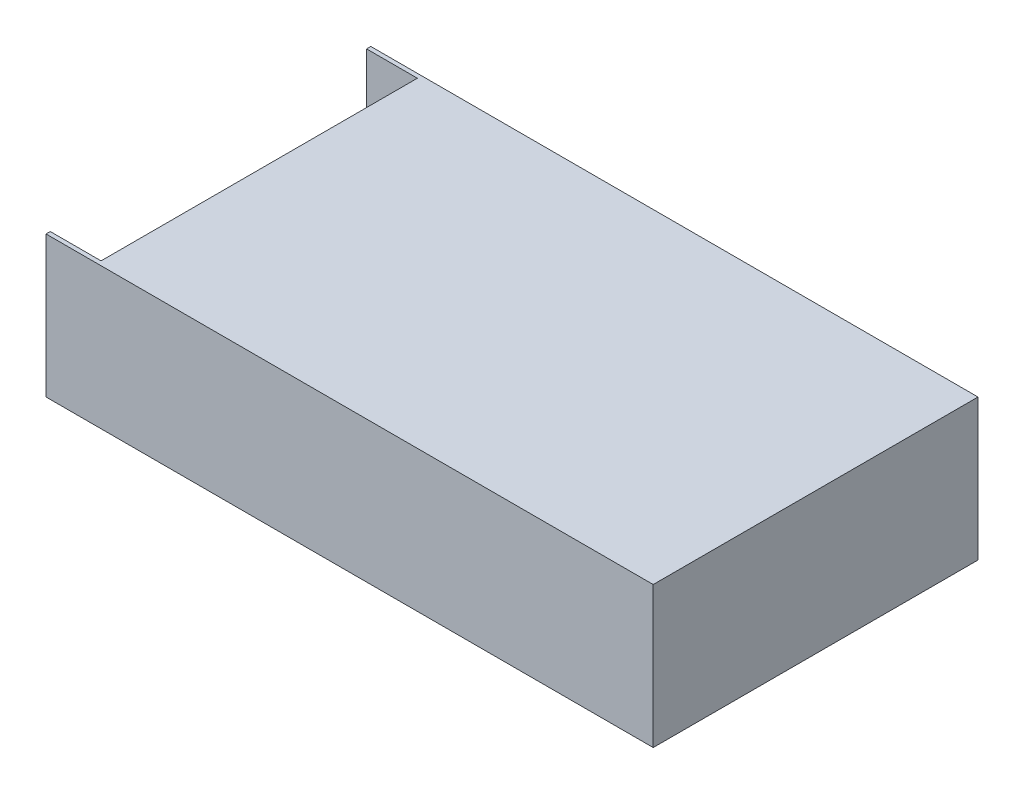
from build123d import *

# Parameters (mm, degrees)
SKETCH1_W           = 215
SKETCH1_H           = 115
BOSS_EXTRUDE1_DEPTH = 50
SKETCH2_W           = 18
SKETCH2_H           = 112
CUT_EXTRUDE2_DEPTH  = 25
SHELL1_START        = -84.5
SHELL1_OUTLINE_W    = 45
SHELL1_OUTLINE_H    = 105
SHELL1_DEPTH        = 187
SHELL1_START_2      = -102.5
SHELL1_2_OUTLINE_W  = 20
SHELL1_2_OUTLINE_H  = 105
SHELL1_2_DEPTH      = 18


# Read off the part's stored shape, not the designer's step: Shell1
with BuildPart() as part:
    # Sketch1 → Boss-Extrude1 (new body)
    with BuildSketch(Plane(origin=(0, 0, 0), x_dir=(1, 0, 0), z_dir=(0, 1, 0))):
        Rectangle(SKETCH1_W, SKETCH1_H)
    extrude(amount=BOSS_EXTRUDE1_DEPTH)

    # Sketch2 → Cut-Extrude2 (cut)
    with BuildSketch(Plane(origin=(0, 50, 0), x_dir=(1, 0, 0), z_dir=(0, 1, 0))):
        with Locations((-98.5, 0)):
            Rectangle(SKETCH2_W, SKETCH2_H)
    extrude(amount=-CUT_EXTRUDE2_DEPTH, mode=Mode.SUBTRACT)

    # Shell1 outline → Shell1 (cut)
    with BuildSketch(Plane.YZ.offset(SHELL1_START)):
        with Locations((22.5, 0)):
            Rectangle(SHELL1_OUTLINE_W, SHELL1_OUTLINE_H)
    extrude(amount=SHELL1_DEPTH, mode=Mode.SUBTRACT)

    # Shell1 2 outline → Shell1 2 (cut)
    with BuildSketch(Plane.YZ.offset(SHELL1_START_2)):
        with Locations((10, 0)):
            Rectangle(SHELL1_2_OUTLINE_W, SHELL1_2_OUTLINE_H)
    extrude(amount=SHELL1_2_DEPTH, mode=Mode.SUBTRACT)


solid = part.part
